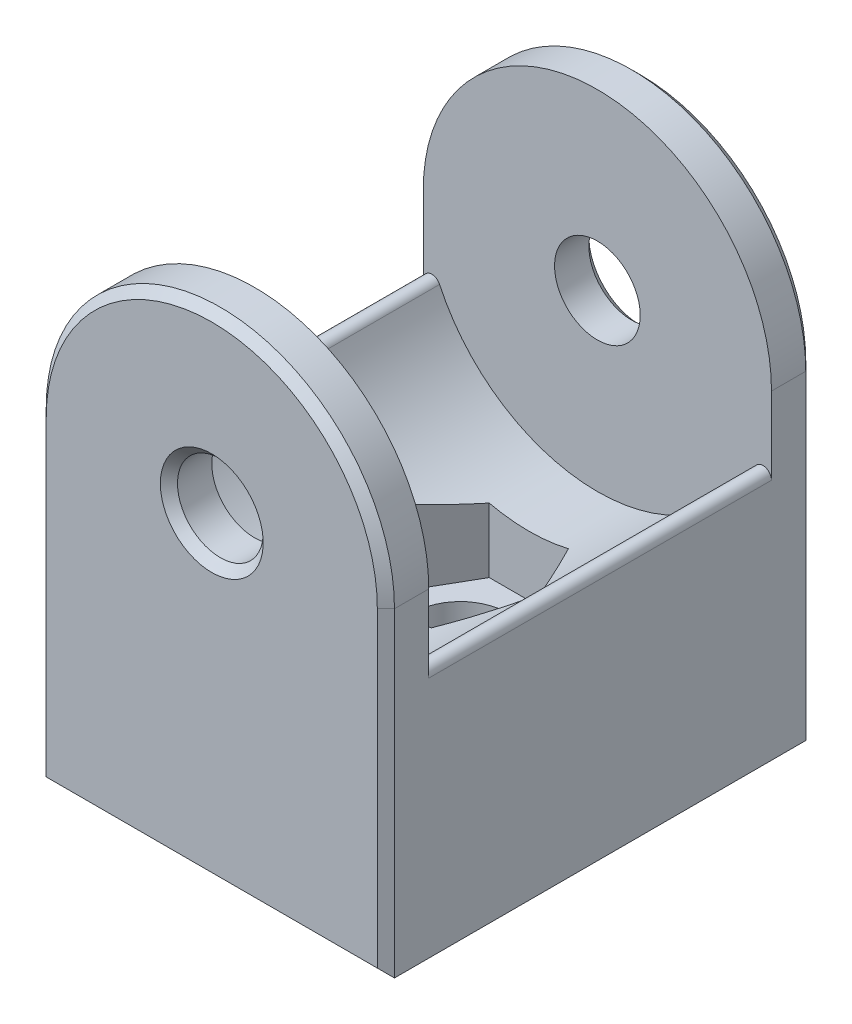
from build123d import *

# Parameters (mm, degrees)
SKETCH1_W               = 20.32
SKETCH1_H               = 25
BOSS_EXTRUDE1_DEPTH     = 28.82
SKETCH2_W               = 20
SKETCH2_H               = 20.32
CUT_EXTRUDE1_DEPTH      = 38.413163459
SKETCH3_R               = 2.5
CUT_EXTRUDE2_DEPTH      = 28.82
BOSS_EXTRUDE2_START     = 20
BOSS_EXTRUDE2_DEPTH     = 20
FILLET1_START           = -10
FILLET1_DEPTH           = 20
CUT_EXTRUDE3_DEPTH      = 34.016177853
CUT_EXTRUDE3_DEPTH_BACK = 3.5
CUT_EXTRUDE3_START      = 8.5
SKETCH5_R               = 2.75
CUT_EXTRUDE4_DEPTH      = 29.755312553
CHAMFER1_SIZE           = 0.5


with BuildPart() as part:
    # Sketch1 → Boss-Extrude1 (new body)
    with BuildSketch(Plane(origin=(0, 0, 0), x_dir=(1, 0, 0), z_dir=(0, 1, 0))):
        Rectangle(SKETCH1_W, SKETCH1_H)
    extrude(amount=BOSS_EXTRUDE1_DEPTH)

    # Sketch2 → Cut-Extrude1 (cut, through all)
    with BuildSketch(Plane(origin=(10.16, 0, 0), x_dir=(0, 0, -1), z_dir=(1, 0, 0))):
        with Locations((0, 18.66)):
            Rectangle(SKETCH2_W, SKETCH2_H)
    extrude(amount=-CUT_EXTRUDE1_DEPTH, mode=Mode.SUBTRACT)

    # Sketch3 → Cut-Extrude2 (cut)
    with BuildSketch(Plane.XY.offset(12.5)):
        with Locations((0, 18.66)):
            Circle(SKETCH3_R)
        with BuildLine():
            Line((-10.16, 18.66), (-10.16, 30.66))
            Line((-10.16, 30.66), (10.16, 30.66))
            Line((10.16, 30.66), (10.16, 18.66))
            ThreePointArc((10.16, 18.66), (0, 28.82), (-10.16, 18.66))
        make_face()
    extrude(amount=-CUT_EXTRUDE2_DEPTH, mode=Mode.SUBTRACT)

    # Sketch7 → Boss-Extrude2 (add)
    with BuildSketch(Plane.XY.offset(-10).offset(BOSS_EXTRUDE2_START)):
        with BuildLine():
            Line((10.16, 18.66), (10.16, 0))
            Line((10.16, 0), (-10.16, 0))
            Line((-10.16, 0), (-10.16, 18.66))
            ThreePointArc((-10.16, 18.66), (0, 8.5), (10.16, 18.66))
        make_face()
    extrude(amount=-BOSS_EXTRUDE2_DEPTH)

    # Fillet1: read off the stored shape, not the designer's step
    # Fillet1 outline → Fillet1 (cut)
    with BuildSketch(Plane.XY.offset(FILLET1_START)):
        with BuildLine():
            ThreePointArc((10.16, 18.66), (9.918864548, 16.459607744), (9.206904315, 14.363662847))
            ThreePointArc((9.206904315, 14.363662847), (9.76828702, 14.64036203), (10.16, 14.152228932))
            Line((10.16, 14.152228932), (10.16, 18.66))
        make_face()
        with BuildLine():
            ThreePointArc((-10.16, 14.152228932), (-9.76828702, 14.64036203), (-9.206904315, 14.363662847))
            ThreePointArc((-9.206904315, 14.363662847), (-9.918864548, 16.459607744), (-10.16, 18.66))
            Line((-10.16, 18.66), (-10.16, 14.152228932))
        make_face()
    extrude(amount=FILLET1_DEPTH, mode=Mode.SUBTRACT)

    # Sketch4 → Cut-Extrude3 (cut, two sides: drawn at the far end of the back side and taken through both)
    with BuildSketch(Plane(origin=(0, 0, 0), x_dir=(1, 0, 0), z_dir=(0, 1, 0)).offset(CUT_EXTRUDE3_START - CUT_EXTRUDE3_DEPTH_BACK)):
        Polygon((4.618802154, 2), (2.309401077, 6), (-2.309401077, 6), (-4.618802154, 2), (-2.309401077, -2), (2.309401077, -2), align=None)
    extrude(amount=CUT_EXTRUDE3_DEPTH + CUT_EXTRUDE3_DEPTH_BACK, mode=Mode.SUBTRACT)

    # Sketch5 → Cut-Extrude4 (cut, through all)
    with BuildSketch(Plane(origin=(0, 5, 0), x_dir=(1, 0, 0), z_dir=(0, 1, 0))):
        with Locations(Location((0, 2, 0), (0, 0, 270))):
            Circle(SKETCH5_R)
    extrude(amount=-CUT_EXTRUDE4_DEPTH, mode=Mode.SUBTRACT)

    # Chamfer1
    chamfer1_edges = [part.edges().sort_by_distance(p)[0] for p in [
        (10.16, 9.33, 12.5),
        (-10.16, 9.33, 12.5),
        (-10.16, 9.33, -12.5),
        (10.16, 9.33, -12.5),
        (-2.5, 18.66, -12.5),
        (-2.5, 18.66, 12.5),
        (0, 28.82, 12.5),
        (0, 28.82, -12.5),
        (0, 0, 12.5),
        (0, 0, -12.5),
    ]]
    chamfer(chamfer1_edges, length=CHAMFER1_SIZE)


solid = part.part
